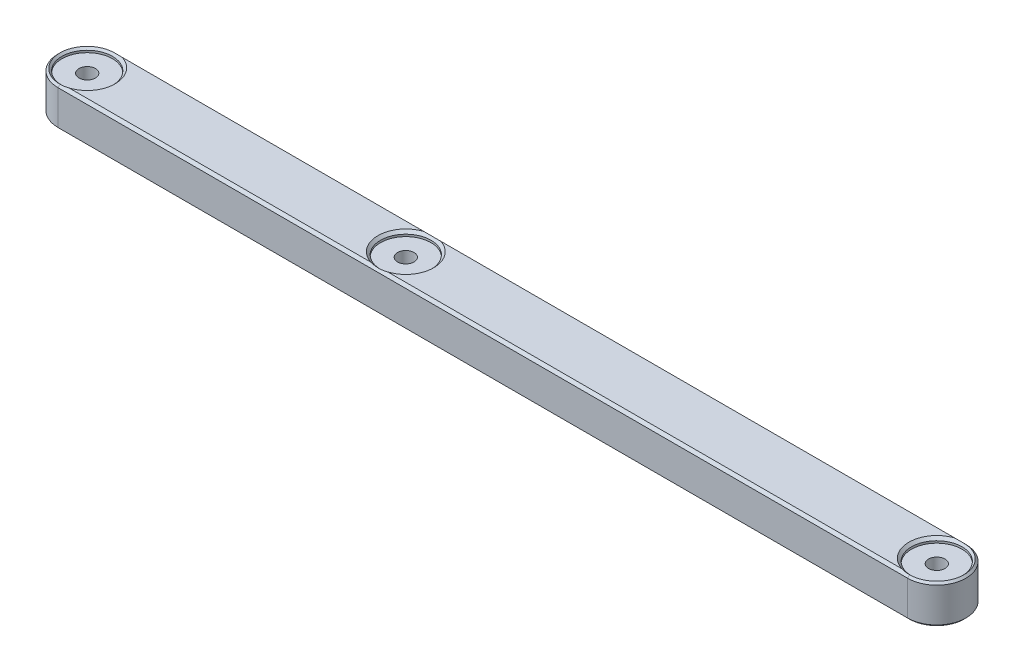
from build123d import *

# Parameters (mm, degrees)
SKETCH1_R           = 3.1
BOSS_EXTRUDE1_DEPTH = 15
SKETCH2_R           = 9.5
CUT_EXTRUDE1_DEPTH  = 1.8
CHAMFER2_SIZE       = 1


with BuildPart() as part:
    # Sketch1 → Boss-Extrude1 (new body)
    with BuildSketch(Plane(origin=(0, 0, 0), x_dir=(1, 0, 0), z_dir=(0, 1, 0))):
        with BuildLine():
            Line((-160, 11), (160, 11))
            ThreePointArc((160, 11), (171, 0), (160, -11))
            Line((160, -11), (-160, -11))
            ThreePointArc((-160, -11), (-171, 0), (-160, 11))
        make_face()
        with Locations(Location((-160, 0, 0), (0, 0, 270))):
            Circle(SKETCH1_R, mode=Mode.SUBTRACT)
        with Locations(Location((160, 0, 0), (0, 0, 270))):
            Circle(SKETCH1_R, mode=Mode.SUBTRACT)
        with Locations(Location((-40, 0, 0), (0, 0, 270))):
            Circle(SKETCH1_R, mode=Mode.SUBTRACT)
    extrude(amount=BOSS_EXTRUDE1_DEPTH)

    # Sketch2 → Cut-Extrude1 (cut)
    with BuildSketch(Plane(origin=(0, 15, 0), x_dir=(1, 0, 0), z_dir=(0, 1, 0))):
        with Locations(Location((160, 0, 0), (0, 0, 270))):
            Circle(SKETCH2_R)
        with Locations(Location((-40, 0, 0), (0, 0, 270))):
            Circle(SKETCH2_R)
        with Locations(Location((-160, 0, 0), (0, 0, 270))):
            Circle(SKETCH2_R)
    cut_extrude1 = extrude(amount=-CUT_EXTRUDE1_DEPTH, mode=Mode.SUBTRACT)

    # Chamfer2
    chamfer2_edges = [part.edges().sort_by_distance(p)[0] for p in [
        (171, 15, 0),
        (0, 15, -11),
        (-171, 15, 0),
        (0, 0, -11),
        (171, 0, 0),
        (0, 0, 11),
        (-171, 0, 0),
        (0, 15, 11),
    ]]
    chamfer(chamfer2_edges, length=CHAMFER2_SIZE)

    # Mirror1: Cut-Extrude1 across plane
    add(cut_extrude1.mirror(Plane.ZX.offset(7.5)), mode=Mode.SUBTRACT)

    # Chamfer1: read off the stored shape, not the designer's step
    # Chamfer1: loft between two sections, ruled curve by curve
    chamfer1_from = [
        Edge.make_three_point_arc((-160, 1, 9.5), (-169.5, 1, 0), (-160, 1, -9.5)),
        Edge.make_three_point_arc((-160, 1, -9.5), (-150.5, 1, 0), (-160, 1, 9.5)),
    ]
    chamfer1_to = [
        Edge.make_three_point_arc((-160, 0, 10.5), (-170.5, 0, 0), (-160, 0, -10.5)),
        Edge.make_three_point_arc((-160, 0, -10.5), (-149.5, 0, 0), (-160, 0, 10.5)),
    ]
    chamfer1 = Solid(Shell([*[Face.make_surface_from_curves(chamfer1_from[k], chamfer1_to[k]) for k in range(2)], Face(Wire(chamfer1_from)), Face(Wire(chamfer1_to))]))
    add(chamfer1, mode=Mode.SUBTRACT)

    # Chamfer1 2: loft between two sections, ruled curve by curve
    chamfer1_2_from = [
        Edge.make_three_point_arc((-37.103348559, 1, -9.047619048), (-30.952380952, 1, 2.896651441), (-42.896651441, 1, 9.047619048)),
        Edge.make_three_point_arc((-42.896651441, 1, 9.047619048), (-49.047619048, 1, -2.896651441), (-37.103348559, 1, -9.047619048)),
    ]
    chamfer1_2_to = [
        Edge.make_three_point_arc((-36.798437881, 0, -10), (-30, 0, 3.201562119), (-43.201562119, 0, 10)),
        Edge.make_three_point_arc((-43.201562119, 0, 10), (-50, 0, -3.201562119), (-36.798437881, 0, -10)),
    ]
    chamfer1_2 = Solid(Shell([*[Face.make_surface_from_curves(chamfer1_2_from[k], chamfer1_2_to[k]) for k in range(2)], Face(Wire(chamfer1_2_from)), Face(Wire(chamfer1_2_to))]))
    add(chamfer1_2, mode=Mode.SUBTRACT)

    # Chamfer1 3: loft between two sections, ruled curve by curve
    chamfer1_3_from = [
        Edge.make_three_point_arc((160, 1, 9.5), (150.5, 1, 0), (160, 1, -9.5)),
        Edge.make_three_point_arc((160, 1, -9.5), (169.5, 1, 0), (160, 1, 9.5)),
    ]
    chamfer1_3_to = [
        Edge.make_three_point_arc((160, 0, 10.5), (149.5, 0, 0), (160, 0, -10.5)),
        Edge.make_three_point_arc((160, 0, -10.5), (170.5, 0, 0), (160, 0, 10.5)),
    ]
    chamfer1_3 = Solid(Shell([*[Face.make_surface_from_curves(chamfer1_3_from[k], chamfer1_3_to[k]) for k in range(2)], Face(Wire(chamfer1_3_from)), Face(Wire(chamfer1_3_to))]))
    add(chamfer1_3, mode=Mode.SUBTRACT)

    # Chamfer1 4: loft between two sections, ruled curve by curve
    chamfer1_4_from = [
        Edge.make_three_point_arc((160, 14, 9.5), (169.5, 14, 0), (160, 14, -9.5)),
        Edge.make_three_point_arc((160, 14, -9.5), (150.5, 14, 0), (160, 14, 9.5)),
    ]
    chamfer1_4_to = [
        Edge.make_three_point_arc((160, 15, 10.5), (170.5, 15, 0), (160, 15, -10.5)),
        Edge.make_three_point_arc((160, 15, -10.5), (149.5, 15, 0), (160, 15, 10.5)),
    ]
    chamfer1_4 = Solid(Shell([*[Face.make_surface_from_curves(chamfer1_4_from[k], chamfer1_4_to[k]) for k in range(2)], Face(Wire(chamfer1_4_from)), Face(Wire(chamfer1_4_to))]))
    add(chamfer1_4, mode=Mode.SUBTRACT)

    # Chamfer1 5: loft between two sections, ruled curve by curve
    chamfer1_5_from = [
        Edge.make_three_point_arc((-40, 14, 9.5), (-30.5, 14, 0), (-40, 14, -9.5)),
        Edge.make_three_point_arc((-40, 14, -9.5), (-49.5, 14, 0), (-40, 14, 9.5)),
    ]
    chamfer1_5_to = [
        Edge.make_three_point_arc((-40, 15, 10.5), (-29.5, 15, 0), (-40, 15, -10.5)),
        Edge.make_three_point_arc((-40, 15, -10.5), (-50.5, 15, 0), (-40, 15, 10.5)),
    ]
    chamfer1_5 = Solid(Shell([*[Face.make_surface_from_curves(chamfer1_5_from[k], chamfer1_5_to[k]) for k in range(2)], Face(Wire(chamfer1_5_from)), Face(Wire(chamfer1_5_to))]))
    add(chamfer1_5, mode=Mode.SUBTRACT)

    # Chamfer1 6: loft between two sections, ruled curve by curve
    chamfer1_6_from = [
        Edge.make_three_point_arc((-160, 14, 9.5), (-150.5, 14, 0), (-160, 14, -9.5)),
        Edge.make_three_point_arc((-160, 14, -9.5), (-169.5, 14, 0), (-160, 14, 9.5)),
    ]
    chamfer1_6_to = [
        Edge.make_three_point_arc((-160, 15, 10.5), (-149.5, 15, 0), (-160, 15, -10.5)),
        Edge.make_three_point_arc((-160, 15, -10.5), (-170.5, 15, 0), (-160, 15, 10.5)),
    ]
    chamfer1_6 = Solid(Shell([*[Face.make_surface_from_curves(chamfer1_6_from[k], chamfer1_6_to[k]) for k in range(2)], Face(Wire(chamfer1_6_from)), Face(Wire(chamfer1_6_to))]))
    add(chamfer1_6, mode=Mode.SUBTRACT)


solid = part.part
